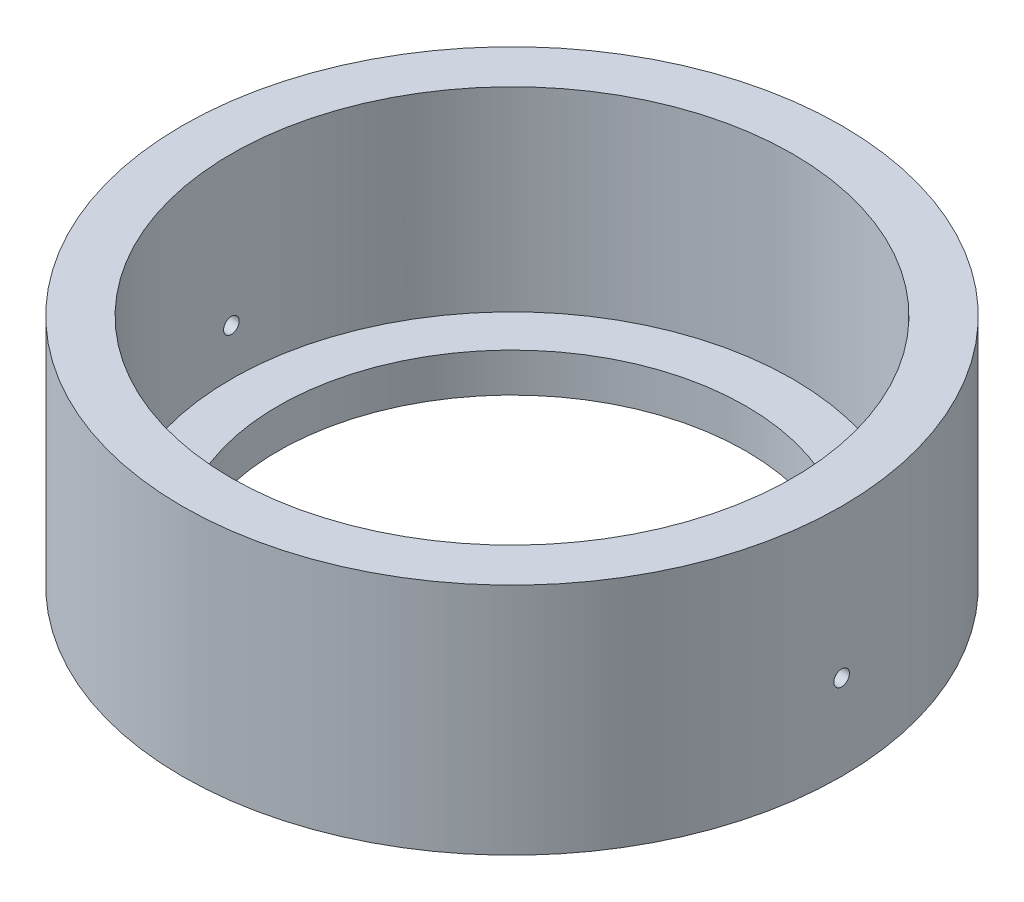
from build123d import *

# Parameters (mm, degrees)
SKETCH1_R               = 42.285
SKETCH1_R_2             = 36
BOSS_EXTRUDE1_DEPTH     = 30
SKETCH2_R               = 40
SKETCH2_R_2             = 37.5
CUT_EXTRUDE1_DEPTH      = 4.6
CUT_EXTRUDE2_DEPTH      = 67.903231985
CUT_EXTRUDE2_DEPTH_BACK = 67.903231985
SKETCH3_R               = 1
SKETCH4_R               = 36.818851793
SKETCH4_R_2             = 30
BOSS_EXTRUDE2_DEPTH     = 5


with BuildPart() as part:
    # Sketch1 → Boss-Extrude1 (new body)
    with BuildSketch(Plane(origin=(0, 0, 0), x_dir=(1, 0, 0), z_dir=(0, 1, 0))):
        Circle(SKETCH1_R)
        Circle(SKETCH1_R_2, mode=Mode.SUBTRACT)
    extrude(amount=BOSS_EXTRUDE1_DEPTH)

    # Sketch2 → Cut-Extrude1 (cut)
    with BuildSketch(Plane.XZ):
        Circle(SKETCH2_R)
        Circle(SKETCH2_R_2, mode=Mode.SUBTRACT)
    extrude(amount=-CUT_EXTRUDE1_DEPTH, mode=Mode.SUBTRACT)

    # Sketch3 → Cut-Extrude2 (cut, two sides: drawn at the far end of the back side and taken through both)
    with BuildSketch(Plane(origin=(0, 0, 0), x_dir=(0, 0, -1), z_dir=(1, 0, 0)).offset(-CUT_EXTRUDE2_DEPTH_BACK)):
        with Locations((0, 10.95)):
            Circle(SKETCH3_R)
    extrude(amount=CUT_EXTRUDE2_DEPTH + CUT_EXTRUDE2_DEPTH_BACK, mode=Mode.SUBTRACT)

    # Sketch4 → Boss-Extrude2 (add)
    with BuildSketch(Plane.XZ):
        Circle(SKETCH4_R)
        Circle(SKETCH4_R_2, mode=Mode.SUBTRACT)
    extrude(amount=-BOSS_EXTRUDE2_DEPTH)


solid = part.part
